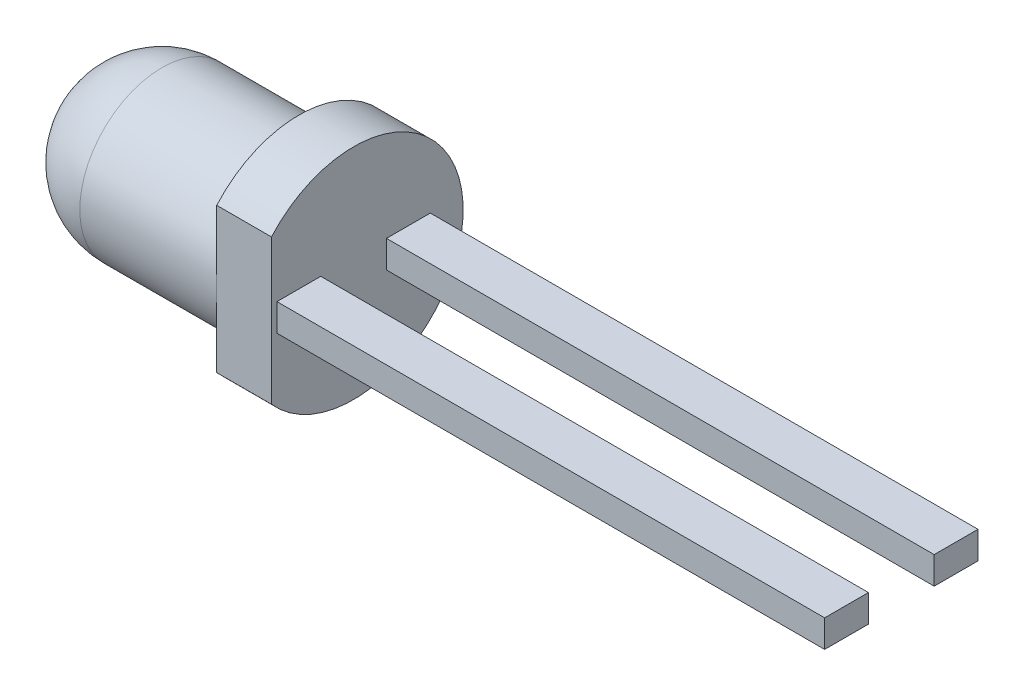
from build123d import *

# Parameters (mm, degrees)
SKETCH_2_W          = 0.8
SKETCH_2_H          = 0.5
EXTRUDE_1_DEPTH     = 10
EXTRUDE_1_2_DEPTH   = 10
SKETCH_3_W          = 1
SKETCH_3_H          = 2.645751312
CUT_EXTRUDE_1_DEPTH = 12.357816692


with BuildPart() as part:
    # Эскиз1 → Повернуть1 (revolve)
    with BuildSketch(Plane.XY):
        with BuildLine():
            Line((0, 0), (0, 2))
            Line((0, 2), (-1, 2))
            Line((-1, 2), (-1, 1.5))
            Line((-1, 1.5), (-3.5, 1.5))
            ThreePointArc((-3.5, 1.5), (-4.560660172, 1.060660172), (-5, 0))
            Line((-5, 0), (0, 0))
        make_face()
    revolve(axis=Axis((0, 0, 0), (-1, 0, 0)))

    # Эскиз3 → Вырез-Вытянуть1 (cut, through all)
    with BuildSketch(Plane.ZY.offset(1)):
        with Locations((2, 0)):
            Rectangle(SKETCH_3_W, SKETCH_3_H)
    extrude(amount=-CUT_EXTRUDE_1_DEPTH, mode=Mode.SUBTRACT)


with BuildPart() as body_2:
    # Эскиз2 → Бобышка-Вытянуть1 (new body)
    with BuildSketch(Plane(origin=(0, 0, 0), x_dir=(0, 0, -1), z_dir=(1, 0, 0))):
        with Locations((-1, 0)):
            Rectangle(SKETCH_2_W, SKETCH_2_H)
    extrude(amount=EXTRUDE_1_DEPTH)


with BuildPart() as body_3:
    # Эскиз2 → Extrude 1 2 (new body)
    with BuildSketch(Plane(origin=(0, 0, 0), x_dir=(0, 0, -1), z_dir=(1, 0, 0))):
        with Locations((1, 0)):
            Rectangle(SKETCH_2_W, SKETCH_2_H)
    extrude(amount=EXTRUDE_1_2_DEPTH)


solid = Compound([part.part, body_2.part, body_3.part])
